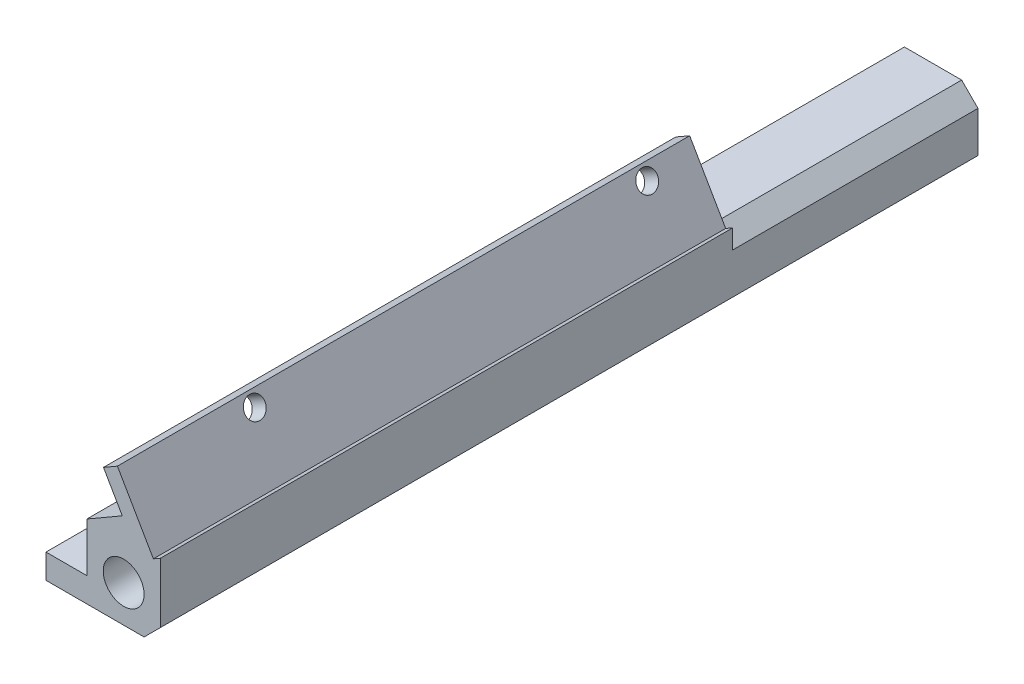
from build123d import *

# Parameters (mm, degrees)
SKETCH1_W           = 77.47
SKETCH1_H           = 127
BOSS_EXTRUDE1_DEPTH = 11.43
SKETCH2_R           = 3.175
CUT_EXTRUDE1_DEPTH  = 150.202030147
CUT_EXTRUDE2_DEPTH  = 150.202030147
SKETCH4_W           = 54.61
SKETCH4_H           = 6.35
CUT_EXTRUDE3_DEPTH  = 150.202030147
CHAMFER1_SIZE       = 2.54
SKETCH5_W           = 66.04
SKETCH5_H           = 50.8
CUT_EXTRUDE4_DEPTH  = 150.202030147
SKETCH6_W           = 53.34
SKETCH6_H           = 76.2
CUT_EXTRUDE5_DEPTH  = 150.202030147
SKETCH7_R           = 1.5875
CUT_EXTRUDE6_DEPTH  = 149.899037606
BOSS_EXTRUDE2_DEPTH = 88.9
CUT_EXTRUDE7_REACH  = 152.316
SKETCH9_W           = 6.35
SKETCH9_H           = 5.08
CUT_EXTRUDE8_REACH  = 152.316
SKETCH10_W          = 6.35
SKETCH10_H          = 1.27
CUT_EXTRUDE9_REACH  = 134.793
SKETCH11_R          = 1.5875
SKETCH12_W          = 88.9
SKETCH12_H          = 11.176
CUT_EXTRUDE10_DEPTH = 1.27


with BuildPart() as part:
    # Sketch1 → Boss-Extrude1 (new body)
    with BuildSketch(Plane(origin=(0, 0, 0), x_dir=(1, 0, 0), z_dir=(0, 1, 0))):
        with Locations((38.735, 63.5)):
            Rectangle(SKETCH1_W, SKETCH1_H)
    extrude(amount=BOSS_EXTRUDE1_DEPTH)

    # Sketch2 → Cut-Extrude1 (cut, through all)
    with BuildSketch(Plane.XY):
        with Locations((5.715, 5.715)):
            Circle(SKETCH2_R)
        with Locations((71.755, 5.715)):
            Circle(SKETCH2_R)
    extrude(amount=-CUT_EXTRUDE1_DEPTH, mode=Mode.SUBTRACT)

    # Sketch3 → Cut-Extrude2 (cut, through all)
    with BuildSketch(Plane(origin=(0, 11.43, 0), x_dir=(1, 0, 0), z_dir=(0, 1, 0))):
        with BuildLine():
            Line((11.43, 127), (11.43, 88.9))
            ThreePointArc((11.43, 88.9), (15.149743879, 79.919743879), (24.13, 76.2))
            Line((24.13, 76.2), (53.34, 76.2))
            ThreePointArc((53.34, 76.2), (62.320256121, 79.919743879), (66.04, 88.9))
            Line((66.04, 88.9), (66.04, 127))
            Line((66.04, 127), (11.43, 127))
        make_face()
    extrude(amount=-CUT_EXTRUDE2_DEPTH, mode=Mode.SUBTRACT)

    # Sketch4 → Cut-Extrude3 (cut, through all)
    with BuildSketch(Plane(origin=(0, 0, -127), x_dir=(-1, 0, 0), z_dir=(0, 0, -1))):
        with Locations((-38.735, 8.255)):
            Rectangle(SKETCH4_W, SKETCH4_H)
    extrude(amount=-CUT_EXTRUDE3_DEPTH, mode=Mode.SUBTRACT)

    # Chamfer1
    chamfer1_edges = [part.edges().sort_by_distance(p)[0] for p in [
        (0, 0, -63.5),
        (0, 11.43, -63.5),
        (77.47, 0, -63.5),
        (77.47, 11.43, -63.5),
    ]]
    chamfer(chamfer1_edges, length=CHAMFER1_SIZE)

    # Sketch5 → Cut-Extrude4 (cut, through all)
    with BuildSketch(Plane(origin=(0, 11.43, 0), x_dir=(1, 0, 0), z_dir=(0, 1, 0))):
        with Locations((33.02, 101.6)):
            Rectangle(SKETCH5_W, SKETCH5_H)
    extrude(amount=-CUT_EXTRUDE4_DEPTH, mode=Mode.SUBTRACT)

    # Sketch6 → Cut-Extrude5 (cut, through all)
    with BuildSketch(Plane(origin=(0, 11.43, 0), x_dir=(1, 0, 0), z_dir=(0, 1, 0))):
        with Locations((26.67, 38.1)):
            Rectangle(SKETCH6_W, SKETCH6_H)
    extrude(amount=-CUT_EXTRUDE5_DEPTH, mode=Mode.SUBTRACT)

    # Sketch7 → Cut-Extrude6 (cut, through all)
    with BuildSketch(Plane(origin=(0, 5.08, 0), x_dir=(1, 0, 0), z_dir=(0, 1, 0))):
        with Locations((62.23, 68.58)):
            Circle(SKETCH7_R)
        with Locations((62.23, 7.62)):
            Circle(SKETCH7_R)
    extrude(amount=-CUT_EXTRUDE6_DEPTH, mode=Mode.SUBTRACT)

    # Sketch8 → Boss-Extrude2 (add)
    with BuildSketch(Plane.XY):
        Polygon((77.47, 11.869940905), (77.47, 7.030590949), (74.93, 11.43), (66.04, 11.43), (71.539261314, 14.605), (68.618261314, 19.664320409), (71.882, 21.548640818), align=None)
    extrude(amount=-BOSS_EXTRUDE2_DEPTH)

    # Sketch9 → Cut-Extrude7 (cut, up to next)
    with BuildSketch(Plane.XY, mode=Mode.PRIVATE) as cut_extrude7_sk1:
        with Locations((56.515, 2.54)):
            Rectangle(SKETCH9_W, SKETCH9_H)
    cut_extrude7_tool1 = extrude(cut_extrude7_sk1.sketch, amount=-CUT_EXTRUDE7_REACH, mode=Mode.PRIVATE) & part.part
    add(cut_extrude7_tool1.solids().sort_by_distance((56.515, 2.54, 0))[0], mode=Mode.SUBTRACT)

    # Sketch10 → Cut-Extrude8 (cut, up to next)
    with BuildSketch(Plane.XY, mode=Mode.PRIVATE) as cut_extrude8_sk1:
        with Locations((62.865, 4.445)):
            Rectangle(SKETCH10_W, SKETCH10_H)
    cut_extrude8_tool1 = extrude(cut_extrude8_sk1.sketch, amount=-CUT_EXTRUDE8_REACH, mode=Mode.PRIVATE) & part.part
    add(cut_extrude8_tool1.solids().sort_by_distance((62.865, 4.445, 0))[0], mode=Mode.SUBTRACT)

    # Sketch11 → Cut-Extrude9 (cut, up to next)
    with BuildSketch(Plane(origin=(59.978596497, 34.628658833, 0), x_dir=(0, 0, 1), z_dir=(-0.8660254037844403, -0.49999999999999745, 0)), mode=Mode.PRIVATE) as cut_extrude9_sk1:
        with Locations((-20.32, -19.311329635)):
            Circle(SKETCH11_R)
    cut_extrude9_tool1 = extrude(cut_extrude9_sk1.sketch, amount=-CUT_EXTRUDE9_REACH, mode=Mode.PRIVATE) & part.part
    # Sketch11 → Cut-Extrude9 (cut, up to next)
    with BuildSketch(Plane(origin=(59.978596497, 34.628658833, 0), x_dir=(0, 0, 1), z_dir=(-0.8660254037844403, -0.49999999999999745, 0)), mode=Mode.PRIVATE) as cut_extrude9_sk2:
        with Locations((-81.28, -19.311329635)):
            Circle(SKETCH11_R)
    cut_extrude9_tool2 = extrude(cut_extrude9_sk2.sketch, amount=-CUT_EXTRUDE9_REACH, mode=Mode.PRIVATE) & part.part
    add(cut_extrude9_tool1.solids().sort_by_distance((69.634261, 17.904557, -20.32))[0], mode=Mode.SUBTRACT)
    add(cut_extrude9_tool2.solids().sort_by_distance((69.634261, 17.904557, -81.28))[0], mode=Mode.SUBTRACT)

    # Sketch12 → Cut-Extrude10 (cut)
    with BuildSketch(Plane(origin=(63.242335183, 36.512979242, 0), x_dir=(0, 0, -1), z_dir=(0.8660254037844395, 0.49999999999999856, 0))):
        with Locations((44.45, -22.867329635)):
            Rectangle(SKETCH12_W, SKETCH12_H)
    extrude(amount=-CUT_EXTRUDE10_DEPTH, mode=Mode.SUBTRACT)


solid = part.part
